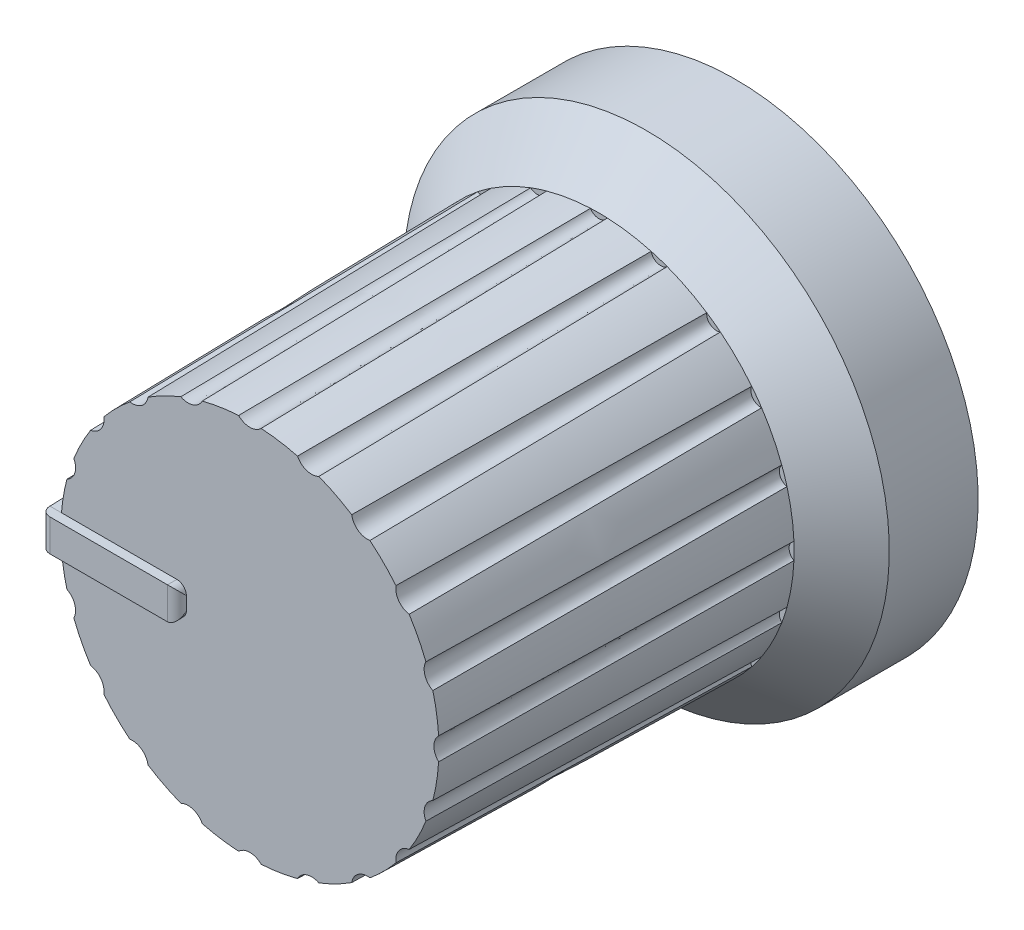
from build123d import *

# Parameters (mm, degrees)
SKETCH1_R                     = 7.65
BOSS_EXTRUDE1_DEPTH           = 4.3
SKETCH2_R                     = 6.15
BOSS_EXTRUDE2_DEPTH           = 11
BOSS_EXTRUDE2_TAPER           = 1
CHAMFER1_SIZE                 = 1.5
SKETCH3_R                     = 0.5
CUT_EXTRUDE2_DEPTH            = 11
CUT_EXTRUDE2_DRAFT            = -1
CUT_EXTRUDE2_PROFILE_2_DEPTH  = 11
CUT_EXTRUDE2_PROFILE_2_DRAFT  = -1
CUT_EXTRUDE2_PROFILE_3_DEPTH  = 11
CUT_EXTRUDE2_PROFILE_3_DRAFT  = -1
CUT_EXTRUDE2_PROFILE_4_DEPTH  = 11
CUT_EXTRUDE2_PROFILE_4_DRAFT  = -1
CUT_EXTRUDE2_PROFILE_5_DEPTH  = 11
CUT_EXTRUDE2_PROFILE_5_DRAFT  = -1
CUT_EXTRUDE2_PROFILE_6_DEPTH  = 11
CUT_EXTRUDE2_PROFILE_6_DRAFT  = -1
CUT_EXTRUDE2_PROFILE_7_DEPTH  = 11
CUT_EXTRUDE2_PROFILE_7_DRAFT  = -1
CUT_EXTRUDE2_PROFILE_8_DEPTH  = 11
CUT_EXTRUDE2_PROFILE_8_DRAFT  = -1
CUT_EXTRUDE2_PROFILE_9_DEPTH  = 11
CUT_EXTRUDE2_PROFILE_9_DRAFT  = -1
CUT_EXTRUDE2_PROFILE_10_DEPTH = 11
CUT_EXTRUDE2_PROFILE_10_DRAFT = -1
CUT_EXTRUDE2_PROFILE_11_DEPTH = 11
CUT_EXTRUDE2_PROFILE_11_DRAFT = -1
CUT_EXTRUDE2_PROFILE_12_DEPTH = 11
CUT_EXTRUDE2_PROFILE_12_DRAFT = -1
CUT_EXTRUDE2_PROFILE_13_DEPTH = 11
CUT_EXTRUDE2_PROFILE_13_DRAFT = -1
CUT_EXTRUDE2_PROFILE_14_DEPTH = 11
CUT_EXTRUDE2_PROFILE_14_DRAFT = -1
CUT_EXTRUDE2_PROFILE_15_DEPTH = 11
CUT_EXTRUDE2_PROFILE_15_DRAFT = -1
CUT_EXTRUDE2_PROFILE_16_DEPTH = 11
CUT_EXTRUDE2_PROFILE_16_DRAFT = -1
CUT_EXTRUDE2_PROFILE_17_DEPTH = 11
CUT_EXTRUDE2_PROFILE_17_DRAFT = -1
CUT_EXTRUDE2_PROFILE_18_DEPTH = 11
CUT_EXTRUDE2_PROFILE_18_DRAFT = -1
CUT_EXTRUDE2_PROFILE_19_DEPTH = 11
CUT_EXTRUDE2_PROFILE_19_DRAFT = -1
CUT_EXTRUDE2_PROFILE_20_DEPTH = 11
CUT_EXTRUDE2_PROFILE_20_DRAFT = -1
SKETCH4_W                     = 4.3
SKETCH4_H                     = 1
BOSS_EXTRUDE3_DEPTH           = 12
BOSS_EXTRUDE3_TAPER           = -1
BOSS_EXTRUDE3_OTHER_WAY_DEPTH = 0.3
BOSS_EXTRUDE3_OTHER_WAY_TAPER = -1
FILLET1_R                     = 0.3
FILLET2_R                     = 0.3
SKETCH5_R                     = 5.9
CUT_EXTRUDE3_DEPTH            = 3
SKETCH7_R                     = 3
CUT_EXTRUDE4_DEPTH            = 11


# Some blends are built 0.0001 mm under size
with BuildPart() as part:
    # Sketch1 → Boss-Extrude1 (new body)
    with BuildSketch(Plane.XY):
        with Locations(Location((0, 0, 0), (0, 0, 180))):
            Circle(SKETCH1_R)
    extrude(amount=BOSS_EXTRUDE1_DEPTH)

    # Sketch2 → Boss-Extrude2 (add)
    with BuildSketch(Plane.XY.offset(4.3)):
        Circle(SKETCH2_R)
    extrude(amount=BOSS_EXTRUDE2_DEPTH, taper=BOSS_EXTRUDE2_TAPER)

    # Chamfer1
    chamfer1_edges = [part.edges().sort_by_distance(p)[0] for p in [
        (7.65, 0, 4.3),
    ]]
    chamfer(chamfer1_edges, length=CHAMFER1_SIZE - 0.0001)  # a hair under: the kernel refuses the full size


with BuildPart() as cut_extrude2_tool:
    # Sketch3 → Cut-Extrude2 (with draft: the straight prism first)
    with BuildSketch(Plane.XY.offset(15.3)):
        with Locations((0, 6.3)):
            Circle(SKETCH3_R)
    extrude(amount=-CUT_EXTRUDE2_DEPTH)
    # Cut-Extrude2: the draft: its side faces are tilted about the plane it starts from
    cut_extrude2_sides = [cut_extrude2_tool.faces().sort_by_distance(p)[0] for p in [
        (-0.5, 6.3, 9.8),
    ]]
    draft(cut_extrude2_sides, Plane.XY.offset(15.3), CUT_EXTRUDE2_DRAFT)


with BuildPart() as part_1:
    add(part.part)

    # Cut-Extrude2: cut by cut_extrude2_tool
    add(cut_extrude2_tool.part, mode=Mode.SUBTRACT)


with BuildPart() as cut_extrude2_profile_2_tool:
    # Sketch3 → Cut-Extrude2 profile 2 (with draft: the straight prism first)
    with BuildSketch(Plane.XY.offset(15.3)):
        with Locations((1.946807065, 5.991656053)):
            Circle(SKETCH3_R)
    extrude(amount=-CUT_EXTRUDE2_PROFILE_2_DEPTH)
    # Cut-Extrude2 profile 2: the draft: its side faces are tilted about the plane it starts from
    cut_extrude2_profile_2_sides = [cut_extrude2_profile_2_tool.faces().sort_by_distance(p)[0] for p in [
        (1.446807065, 5.991656053, 9.8),
    ]]
    draft(cut_extrude2_profile_2_sides, Plane.XY.offset(15.3), CUT_EXTRUDE2_PROFILE_2_DRAFT)


with BuildPart() as part_2:
    add(part_1.part)

    # Cut-Extrude2 profile 2: cut by cut_extrude2_profile_2_tool
    add(cut_extrude2_profile_2_tool.part, mode=Mode.SUBTRACT)


with BuildPart() as cut_extrude2_profile_3_tool:
    # Sketch3 → Cut-Extrude2 profile 3 (with draft: the straight prism first)
    with BuildSketch(Plane.XY.offset(15.3)):
        with Locations((3.703047089, 5.096807065)):
            Circle(SKETCH3_R)
    extrude(amount=-CUT_EXTRUDE2_PROFILE_3_DEPTH)
    # Cut-Extrude2 profile 3: the draft: its side faces are tilted about the plane it starts from
    cut_extrude2_profile_3_sides = [cut_extrude2_profile_3_tool.faces().sort_by_distance(p)[0] for p in [
        (3.203047089, 5.096807065, 9.8),
    ]]
    draft(cut_extrude2_profile_3_sides, Plane.XY.offset(15.3), CUT_EXTRUDE2_PROFILE_3_DRAFT)


with BuildPart() as part_3:
    add(part_2.part)

    # Cut-Extrude2 profile 3: cut by cut_extrude2_profile_3_tool
    add(cut_extrude2_profile_3_tool.part, mode=Mode.SUBTRACT)


with BuildPart() as cut_extrude2_profile_4_tool:
    # Sketch3 → Cut-Extrude2 profile 4 (with draft: the straight prism first)
    with BuildSketch(Plane.XY.offset(15.3)):
        with Locations((5.096807065, 3.703047089)):
            Circle(SKETCH3_R)
    extrude(amount=-CUT_EXTRUDE2_PROFILE_4_DEPTH)
    # Cut-Extrude2 profile 4: the draft: its side faces are tilted about the plane it starts from
    cut_extrude2_profile_4_sides = [cut_extrude2_profile_4_tool.faces().sort_by_distance(p)[0] for p in [
        (4.596807065, 3.703047089, 9.8),
    ]]
    draft(cut_extrude2_profile_4_sides, Plane.XY.offset(15.3), CUT_EXTRUDE2_PROFILE_4_DRAFT)


with BuildPart() as part_4:
    add(part_3.part)

    # Cut-Extrude2 profile 4: cut by cut_extrude2_profile_4_tool
    add(cut_extrude2_profile_4_tool.part, mode=Mode.SUBTRACT)


with BuildPart() as cut_extrude2_profile_5_tool:
    # Sketch3 → Cut-Extrude2 profile 5 (with draft: the straight prism first)
    with BuildSketch(Plane.XY.offset(15.3)):
        with Locations((5.991656053, 1.946807065)):
            Circle(SKETCH3_R)
    extrude(amount=-CUT_EXTRUDE2_PROFILE_5_DEPTH)
    # Cut-Extrude2 profile 5: the draft: its side faces are tilted about the plane it starts from
    cut_extrude2_profile_5_sides = [cut_extrude2_profile_5_tool.faces().sort_by_distance(p)[0] for p in [
        (5.491656053, 1.946807065, 9.8),
    ]]
    draft(cut_extrude2_profile_5_sides, Plane.XY.offset(15.3), CUT_EXTRUDE2_PROFILE_5_DRAFT)


with BuildPart() as part_5:
    add(part_4.part)

    # Cut-Extrude2 profile 5: cut by cut_extrude2_profile_5_tool
    add(cut_extrude2_profile_5_tool.part, mode=Mode.SUBTRACT)


with BuildPart() as cut_extrude2_profile_6_tool:
    # Sketch3 → Cut-Extrude2 profile 6 (with draft: the straight prism first)
    with BuildSketch(Plane.XY.offset(15.3)):
        with Locations((6.3, 0)):
            Circle(SKETCH3_R)
    extrude(amount=-CUT_EXTRUDE2_PROFILE_6_DEPTH)
    # Cut-Extrude2 profile 6: the draft: its side faces are tilted about the plane it starts from
    cut_extrude2_profile_6_sides = [cut_extrude2_profile_6_tool.faces().sort_by_distance(p)[0] for p in [
        (5.8, 0, 9.8),
    ]]
    draft(cut_extrude2_profile_6_sides, Plane.XY.offset(15.3), CUT_EXTRUDE2_PROFILE_6_DRAFT)


with BuildPart() as part_6:
    add(part_5.part)

    # Cut-Extrude2 profile 6: cut by cut_extrude2_profile_6_tool
    add(cut_extrude2_profile_6_tool.part, mode=Mode.SUBTRACT)


with BuildPart() as cut_extrude2_profile_7_tool:
    # Sketch3 → Cut-Extrude2 profile 7 (with draft: the straight prism first)
    with BuildSketch(Plane.XY.offset(15.3)):
        with Locations((5.991656053, -1.946807065)):
            Circle(SKETCH3_R)
    extrude(amount=-CUT_EXTRUDE2_PROFILE_7_DEPTH)
    # Cut-Extrude2 profile 7: the draft: its side faces are tilted about the plane it starts from
    cut_extrude2_profile_7_sides = [cut_extrude2_profile_7_tool.faces().sort_by_distance(p)[0] for p in [
        (5.491656053, -1.946807065, 9.8),
    ]]
    draft(cut_extrude2_profile_7_sides, Plane.XY.offset(15.3), CUT_EXTRUDE2_PROFILE_7_DRAFT)


with BuildPart() as part_7:
    add(part_6.part)

    # Cut-Extrude2 profile 7: cut by cut_extrude2_profile_7_tool
    add(cut_extrude2_profile_7_tool.part, mode=Mode.SUBTRACT)


with BuildPart() as cut_extrude2_profile_8_tool:
    # Sketch3 → Cut-Extrude2 profile 8 (with draft: the straight prism first)
    with BuildSketch(Plane.XY.offset(15.3)):
        with Locations((5.096807065, -3.703047089)):
            Circle(SKETCH3_R)
    extrude(amount=-CUT_EXTRUDE2_PROFILE_8_DEPTH)
    # Cut-Extrude2 profile 8: the draft: its side faces are tilted about the plane it starts from
    cut_extrude2_profile_8_sides = [cut_extrude2_profile_8_tool.faces().sort_by_distance(p)[0] for p in [
        (4.596807065, -3.703047089, 9.8),
    ]]
    draft(cut_extrude2_profile_8_sides, Plane.XY.offset(15.3), CUT_EXTRUDE2_PROFILE_8_DRAFT)


with BuildPart() as part_8:
    add(part_7.part)

    # Cut-Extrude2 profile 8: cut by cut_extrude2_profile_8_tool
    add(cut_extrude2_profile_8_tool.part, mode=Mode.SUBTRACT)


with BuildPart() as cut_extrude2_profile_9_tool:
    # Sketch3 → Cut-Extrude2 profile 9 (with draft: the straight prism first)
    with BuildSketch(Plane.XY.offset(15.3)):
        with Locations((3.703047089, -5.096807065)):
            Circle(SKETCH3_R)
    extrude(amount=-CUT_EXTRUDE2_PROFILE_9_DEPTH)
    # Cut-Extrude2 profile 9: the draft: its side faces are tilted about the plane it starts from
    cut_extrude2_profile_9_sides = [cut_extrude2_profile_9_tool.faces().sort_by_distance(p)[0] for p in [
        (3.203047089, -5.096807065, 9.8),
    ]]
    draft(cut_extrude2_profile_9_sides, Plane.XY.offset(15.3), CUT_EXTRUDE2_PROFILE_9_DRAFT)


with BuildPart() as part_9:
    add(part_8.part)

    # Cut-Extrude2 profile 9: cut by cut_extrude2_profile_9_tool
    add(cut_extrude2_profile_9_tool.part, mode=Mode.SUBTRACT)


with BuildPart() as cut_extrude2_profile_10_tool:
    # Sketch3 → Cut-Extrude2 profile 10 (with draft: the straight prism first)
    with BuildSketch(Plane.XY.offset(15.3)):
        with Locations((1.946807065, -5.991656053)):
            Circle(SKETCH3_R)
    extrude(amount=-CUT_EXTRUDE2_PROFILE_10_DEPTH)
    # Cut-Extrude2 profile 10: the draft: its side faces are tilted about the plane it starts from
    cut_extrude2_profile_10_sides = [cut_extrude2_profile_10_tool.faces().sort_by_distance(p)[0] for p in [
        (1.446807065, -5.991656053, 9.8),
    ]]
    draft(cut_extrude2_profile_10_sides, Plane.XY.offset(15.3), CUT_EXTRUDE2_PROFILE_10_DRAFT)


with BuildPart() as part_10:
    add(part_9.part)

    # Cut-Extrude2 profile 10: cut by cut_extrude2_profile_10_tool
    add(cut_extrude2_profile_10_tool.part, mode=Mode.SUBTRACT)


with BuildPart() as cut_extrude2_profile_11_tool:
    # Sketch3 → Cut-Extrude2 profile 11 (with draft: the straight prism first)
    with BuildSketch(Plane.XY.offset(15.3)):
        with Locations((0, -6.3)):
            Circle(SKETCH3_R)
    extrude(amount=-CUT_EXTRUDE2_PROFILE_11_DEPTH)
    # Cut-Extrude2 profile 11: the draft: its side faces are tilted about the plane it starts from
    cut_extrude2_profile_11_sides = [cut_extrude2_profile_11_tool.faces().sort_by_distance(p)[0] for p in [
        (-0.5, -6.3, 9.8),
    ]]
    draft(cut_extrude2_profile_11_sides, Plane.XY.offset(15.3), CUT_EXTRUDE2_PROFILE_11_DRAFT)


with BuildPart() as part_11:
    add(part_10.part)

    # Cut-Extrude2 profile 11: cut by cut_extrude2_profile_11_tool
    add(cut_extrude2_profile_11_tool.part, mode=Mode.SUBTRACT)


with BuildPart() as cut_extrude2_profile_12_tool:
    # Sketch3 → Cut-Extrude2 profile 12 (with draft: the straight prism first)
    with BuildSketch(Plane.XY.offset(15.3)):
        with Locations((-1.946807065, -5.991656053)):
            Circle(SKETCH3_R)
    extrude(amount=-CUT_EXTRUDE2_PROFILE_12_DEPTH)
    # Cut-Extrude2 profile 12: the draft: its side faces are tilted about the plane it starts from
    cut_extrude2_profile_12_sides = [cut_extrude2_profile_12_tool.faces().sort_by_distance(p)[0] for p in [
        (-2.446807065, -5.991656053, 9.8),
    ]]
    draft(cut_extrude2_profile_12_sides, Plane.XY.offset(15.3), CUT_EXTRUDE2_PROFILE_12_DRAFT)


with BuildPart() as part_12:
    add(part_11.part)

    # Cut-Extrude2 profile 12: cut by cut_extrude2_profile_12_tool
    add(cut_extrude2_profile_12_tool.part, mode=Mode.SUBTRACT)


with BuildPart() as cut_extrude2_profile_13_tool:
    # Sketch3 → Cut-Extrude2 profile 13 (with draft: the straight prism first)
    with BuildSketch(Plane.XY.offset(15.3)):
        with Locations((-3.703047089, -5.096807065)):
            Circle(SKETCH3_R)
    extrude(amount=-CUT_EXTRUDE2_PROFILE_13_DEPTH)
    # Cut-Extrude2 profile 13: the draft: its side faces are tilted about the plane it starts from
    cut_extrude2_profile_13_sides = [cut_extrude2_profile_13_tool.faces().sort_by_distance(p)[0] for p in [
        (-4.203047089, -5.096807065, 9.8),
    ]]
    draft(cut_extrude2_profile_13_sides, Plane.XY.offset(15.3), CUT_EXTRUDE2_PROFILE_13_DRAFT)


with BuildPart() as part_13:
    add(part_12.part)

    # Cut-Extrude2 profile 13: cut by cut_extrude2_profile_13_tool
    add(cut_extrude2_profile_13_tool.part, mode=Mode.SUBTRACT)


with BuildPart() as cut_extrude2_profile_14_tool:
    # Sketch3 → Cut-Extrude2 profile 14 (with draft: the straight prism first)
    with BuildSketch(Plane.XY.offset(15.3)):
        with Locations((-5.096807065, -3.703047089)):
            Circle(SKETCH3_R)
    extrude(amount=-CUT_EXTRUDE2_PROFILE_14_DEPTH)
    # Cut-Extrude2 profile 14: the draft: its side faces are tilted about the plane it starts from
    cut_extrude2_profile_14_sides = [cut_extrude2_profile_14_tool.faces().sort_by_distance(p)[0] for p in [
        (-5.596807065, -3.703047089, 9.8),
    ]]
    draft(cut_extrude2_profile_14_sides, Plane.XY.offset(15.3), CUT_EXTRUDE2_PROFILE_14_DRAFT)


with BuildPart() as part_14:
    add(part_13.part)

    # Cut-Extrude2 profile 14: cut by cut_extrude2_profile_14_tool
    add(cut_extrude2_profile_14_tool.part, mode=Mode.SUBTRACT)


with BuildPart() as cut_extrude2_profile_15_tool:
    # Sketch3 → Cut-Extrude2 profile 15 (with draft: the straight prism first)
    with BuildSketch(Plane.XY.offset(15.3)):
        with Locations((-5.991656053, -1.946807065)):
            Circle(SKETCH3_R)
    extrude(amount=-CUT_EXTRUDE2_PROFILE_15_DEPTH)
    # Cut-Extrude2 profile 15: the draft: its side faces are tilted about the plane it starts from
    cut_extrude2_profile_15_sides = [cut_extrude2_profile_15_tool.faces().sort_by_distance(p)[0] for p in [
        (-6.491656053, -1.946807065, 9.8),
    ]]
    draft(cut_extrude2_profile_15_sides, Plane.XY.offset(15.3), CUT_EXTRUDE2_PROFILE_15_DRAFT)


with BuildPart() as part_15:
    add(part_14.part)

    # Cut-Extrude2 profile 15: cut by cut_extrude2_profile_15_tool
    add(cut_extrude2_profile_15_tool.part, mode=Mode.SUBTRACT)


with BuildPart() as cut_extrude2_profile_16_tool:
    # Sketch3 → Cut-Extrude2 profile 16 (with draft: the straight prism first)
    with BuildSketch(Plane.XY.offset(15.3)):
        with Locations((-6.3, 0)):
            Circle(SKETCH3_R)
    extrude(amount=-CUT_EXTRUDE2_PROFILE_16_DEPTH)
    # Cut-Extrude2 profile 16: the draft: its side faces are tilted about the plane it starts from
    cut_extrude2_profile_16_sides = [cut_extrude2_profile_16_tool.faces().sort_by_distance(p)[0] for p in [
        (-6.8, 0, 9.8),
    ]]
    draft(cut_extrude2_profile_16_sides, Plane.XY.offset(15.3), CUT_EXTRUDE2_PROFILE_16_DRAFT)


with BuildPart() as part_16:
    add(part_15.part)

    # Cut-Extrude2 profile 16: cut by cut_extrude2_profile_16_tool
    add(cut_extrude2_profile_16_tool.part, mode=Mode.SUBTRACT)


with BuildPart() as cut_extrude2_profile_17_tool:
    # Sketch3 → Cut-Extrude2 profile 17 (with draft: the straight prism first)
    with BuildSketch(Plane.XY.offset(15.3)):
        with Locations((-5.991656053, 1.946807065)):
            Circle(SKETCH3_R)
    extrude(amount=-CUT_EXTRUDE2_PROFILE_17_DEPTH)
    # Cut-Extrude2 profile 17: the draft: its side faces are tilted about the plane it starts from
    cut_extrude2_profile_17_sides = [cut_extrude2_profile_17_tool.faces().sort_by_distance(p)[0] for p in [
        (-6.491656053, 1.946807065, 9.8),
    ]]
    draft(cut_extrude2_profile_17_sides, Plane.XY.offset(15.3), CUT_EXTRUDE2_PROFILE_17_DRAFT)


with BuildPart() as part_17:
    add(part_16.part)

    # Cut-Extrude2 profile 17: cut by cut_extrude2_profile_17_tool
    add(cut_extrude2_profile_17_tool.part, mode=Mode.SUBTRACT)


with BuildPart() as cut_extrude2_profile_18_tool:
    # Sketch3 → Cut-Extrude2 profile 18 (with draft: the straight prism first)
    with BuildSketch(Plane.XY.offset(15.3)):
        with Locations((-5.096807065, 3.703047089)):
            Circle(SKETCH3_R)
    extrude(amount=-CUT_EXTRUDE2_PROFILE_18_DEPTH)
    # Cut-Extrude2 profile 18: the draft: its side faces are tilted about the plane it starts from
    cut_extrude2_profile_18_sides = [cut_extrude2_profile_18_tool.faces().sort_by_distance(p)[0] for p in [
        (-5.596807065, 3.703047089, 9.8),
    ]]
    draft(cut_extrude2_profile_18_sides, Plane.XY.offset(15.3), CUT_EXTRUDE2_PROFILE_18_DRAFT)


with BuildPart() as part_18:
    add(part_17.part)

    # Cut-Extrude2 profile 18: cut by cut_extrude2_profile_18_tool
    add(cut_extrude2_profile_18_tool.part, mode=Mode.SUBTRACT)


with BuildPart() as cut_extrude2_profile_19_tool:
    # Sketch3 → Cut-Extrude2 profile 19 (with draft: the straight prism first)
    with BuildSketch(Plane.XY.offset(15.3)):
        with Locations((-3.703047089, 5.096807065)):
            Circle(SKETCH3_R)
    extrude(amount=-CUT_EXTRUDE2_PROFILE_19_DEPTH)
    # Cut-Extrude2 profile 19: the draft: its side faces are tilted about the plane it starts from
    cut_extrude2_profile_19_sides = [cut_extrude2_profile_19_tool.faces().sort_by_distance(p)[0] for p in [
        (-4.203047089, 5.096807065, 9.8),
    ]]
    draft(cut_extrude2_profile_19_sides, Plane.XY.offset(15.3), CUT_EXTRUDE2_PROFILE_19_DRAFT)


with BuildPart() as part_19:
    add(part_18.part)

    # Cut-Extrude2 profile 19: cut by cut_extrude2_profile_19_tool
    add(cut_extrude2_profile_19_tool.part, mode=Mode.SUBTRACT)


with BuildPart() as cut_extrude2_profile_20_tool:
    # Sketch3 → Cut-Extrude2 profile 20 (with draft: the straight prism first)
    with BuildSketch(Plane.XY.offset(15.3)):
        with Locations((-1.946807065, 5.991656053)):
            Circle(SKETCH3_R)
    extrude(amount=-CUT_EXTRUDE2_PROFILE_20_DEPTH)
    # Cut-Extrude2 profile 20: the draft: its side faces are tilted about the plane it starts from
    cut_extrude2_profile_20_sides = [cut_extrude2_profile_20_tool.faces().sort_by_distance(p)[0] for p in [
        (-2.446807065, 5.991656053, 9.8),
    ]]
    draft(cut_extrude2_profile_20_sides, Plane.XY.offset(15.3), CUT_EXTRUDE2_PROFILE_20_DRAFT)


with BuildPart() as part_20:
    add(part_19.part)

    # Cut-Extrude2 profile 20: cut by cut_extrude2_profile_20_tool
    add(cut_extrude2_profile_20_tool.part, mode=Mode.SUBTRACT)

    # Sketch4 → Boss-Extrude3 (add)
    with BuildSketch(Plane.XY.offset(15.3)):
        with Locations((-4.15, 0)):
            Rectangle(SKETCH4_W, SKETCH4_H)
    extrude(amount=-BOSS_EXTRUDE3_DEPTH, taper=BOSS_EXTRUDE3_TAPER)

    # Sketch4 → Boss-Extrude3 other way (add)
    with BuildSketch(Plane.XY.offset(15.3)):
        with Locations((-4.15, 0)):
            Rectangle(SKETCH4_W, SKETCH4_H)
    extrude(amount=BOSS_EXTRUDE3_OTHER_WAY_DEPTH, taper=BOSS_EXTRUDE3_OTHER_WAY_TAPER)

    # Fillet1
    # the kernel refuses this fillet: 0.3 mm, written as the material it takes off along each edge
    with BuildSketch(Plane(origin=(-6.305236519, 1.268327818, 15.6), x_dir=(0.017452406437139533, 0, -0.9998476951563938), z_dir=(0, -1, 0))) as fillet1_piece_1:
        with BuildLine():
            CenterArc((0.30528142, 0.299954309), FILLET1_R, 179, 90)
            Line((0.005327112, 0.30519003), (-0.000671974, 0.305294745))
            Line((-0.000671974, 0.305294745), (-0.005999086, 0.000104714))
            Line((-0.005999086, 0.000104714), (0, -0.006))
            ThreePointArc((0, -0.006), (0.150022849, -0.006), (0.299940984, -0.005999086))
            Line((0.299940984, -0.005999086), (0.300045698, 0))
        make_face()
    extrude(amount=2.536655636, mode=Mode.SUBTRACT)

    # Fillet2
    # the kernel refuses this fillet: 0.3 mm, written as the material it takes off along each edge
    with BuildSketch(Plane(origin=(-2.013083326, -0.486916674, 14.550456741), x_dir=(-0.9998477415357946, -0.0003045401145809264, 0.017447091479366773), z_dir=(0.01744974916068371, -0.0174497491606826, 0.9996954598818876))) as fillet2_piece_1_section:
        with BuildLine():
            CenterArc((FILLET2_R * 0.999695459882, -FILLET2_R), FILLET2_R, 90, 89.982548479)
            Line((-FILLET2_R * 0.000304493731648, -FILLET2_R * 0.99969541351), (0, 0))
            Line((0, 0), (FILLET2_R * 0.999695459882, 0))
        make_face()
    fillet2_piece_1 = extrude(amount=1.79963458, mode=Mode.PRIVATE)
    fillet2_piece_1 = split(fillet2_piece_1, bisect_by=Plane(origin=(-2.058753604, -0.441246396, 15.3), z_dir=(0, 0, 1)), keep=Keep.TOP, mode=Mode.PRIVATE)
    add(fillet2_piece_1, mode=Mode.SUBTRACT)
    with BuildSketch(Plane(origin=(-2.013083326, 0.486916674, 14.550456741), x_dir=(-0.9998477415357946, 0.00030454011458090066, 0.0174470914793653), z_dir=(0.017449749160682232, 0.017449749160682232, 0.9996954598818876))) as fillet2_piece_2_section:
        with BuildLine():
            CenterArc((FILLET2_R * 0.999695459882, FILLET2_R), FILLET2_R, 180.017451521, 89.982548479)
            Line((-FILLET2_R * 0.000304493731642, FILLET2_R * 0.99969541351), (0, 0))
            Line((0, 0), (FILLET2_R * 0.999695459882, 0))
        make_face()
    fillet2_piece_2 = extrude(amount=1.79963458, mode=Mode.PRIVATE)
    fillet2_piece_2 = split(fillet2_piece_2, bisect_by=Plane(origin=(-2.058753604, 0.441246396, 15.3), z_dir=(0, 0, 1)), keep=Keep.TOP, mode=Mode.PRIVATE)
    add(fillet2_piece_2, mode=Mode.SUBTRACT)
    with BuildSketch(Plane(origin=(-1.994763481, -1.268442064, 15.6), x_dir=(-1, 0, 0), z_dir=(0, 1, 0))) as fillet2_piece_3_section:
        with BuildLine():
            CenterArc((FILLET2_R * 1.01760739297, -FILLET2_R), FILLET2_R, 90, 91)
            Line((FILLET2_R * 0.0177596978157, -FILLET2_R * 1.01745240644), (0, 0))
            Line((0, 0), (FILLET2_R * 1.01760739297, 0))
        make_face()
    fillet2_piece_3 = extrude(amount=2.536884128, mode=Mode.PRIVATE)
    fillet2_piece_3 = split(fillet2_piece_3, bisect_by=Plane(origin=(-2.065317031, 0, 15.3), z_dir=(0, 0, 1)), keep=Keep.TOP, mode=Mode.PRIVATE)
    add(fillet2_piece_3, mode=Mode.SUBTRACT)

    # Sketch5 → Cut-Extrude3 (cut)
    with BuildSketch(Plane(origin=(0, 0, 0), x_dir=(-1, 0, 0), z_dir=(0, 0, -1))):
        Circle(SKETCH5_R)
    extrude(amount=-CUT_EXTRUDE3_DEPTH, mode=Mode.SUBTRACT)

    # Sketch7 → Cut-Extrude4 (cut)
    with BuildSketch(Plane(origin=(0, 0, 3), x_dir=(-1, 0, 0), z_dir=(0, 0, -1))):
        Circle(SKETCH7_R)
    extrude(amount=-CUT_EXTRUDE4_DEPTH, mode=Mode.SUBTRACT)


solid = part_20.part
